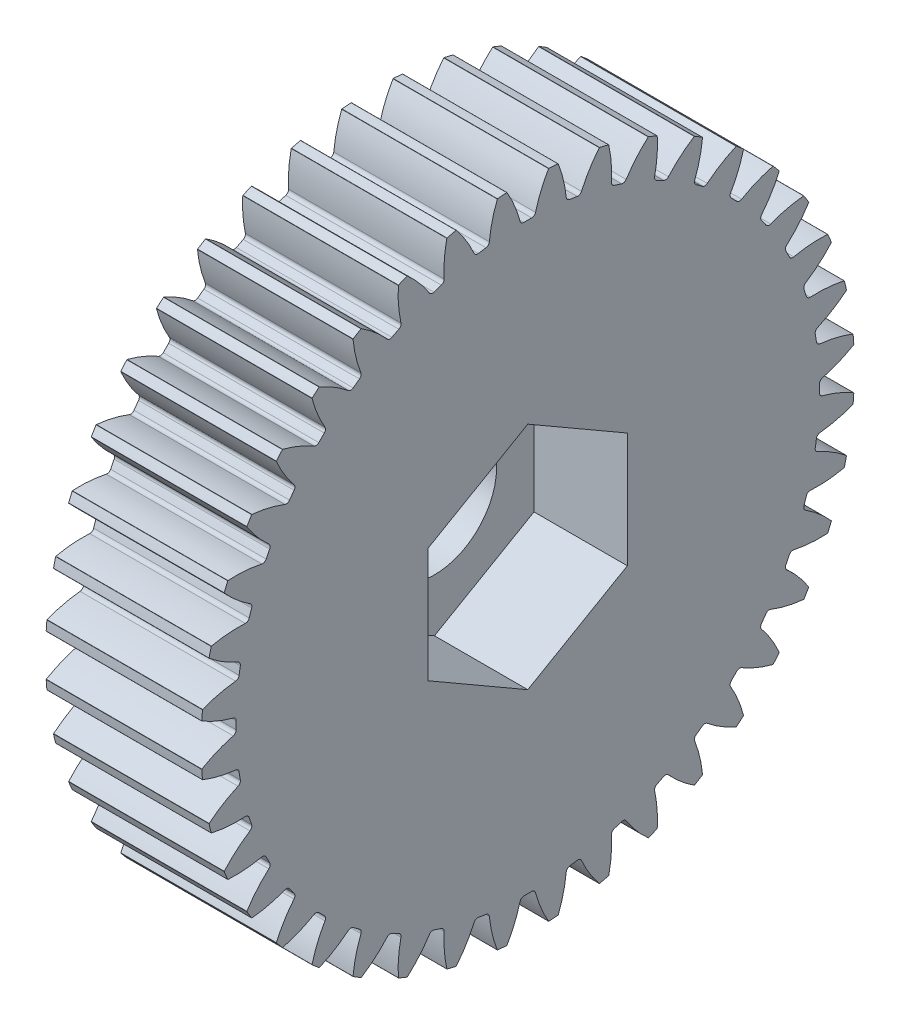
from build123d import *

# Parameters (mm, degrees)
BASPROSKE_W                = 14
BASPROSKE_H                = 21
TOOTHCUT_DEPTH             = 33.832910319
BREAKS_R                   = 0.02
ROOTFILLETS_R              = 0.251
TEETHCUTS_COUNT            = 40
TEETHCUTS_ANGLE            = 351
BREAKS_OF_TEETHCUTS_R      = 0.02
ROOTFILLETS_OF_TEETHCUTS_R = 0.251
BORSKE_R                   = 2
BORE_DEPTH                 = 50.0000508
CUT_EXTRUDE1_DEPTH         = 6
SKETCH1_7_R                = 4
CUT_EXTRUDE2_DEPTH         = 33.777200555
SKETCH2_R                  = 6.5
SKETCH2_R_2                = 4
BOSS_EXTRUDE1_DEPTH        = 3.8
SKETCH4_R                  = 6.5
CUT_EXTRUDE3_DEPTH         = 4
FILLET1_R                  = 3


with BuildPart() as part:
    # BasProSke → Base-Revolve (revolve)
    with BuildSketch(Plane(origin=(0, 0, 0), x_dir=(1, 0, 0), z_dir=(0, 1, 0)), mode=Mode.PRIVATE) as base_revolve_sk:
        with Locations((7, 10.5)):
            Rectangle(BASPROSKE_W, BASPROSKE_H)
    revolve(base_revolve_sk.sketch.rotate(Axis((-10, 0, 0), (1, 0, 0)), 180), axis=Axis((-10, 0, 0), (1, 0, 0)))

    # TooCutSke → ToothCut (cut, through all)
    with BuildSketch(Plane(origin=(0, 0, 0), x_dir=(0, 0, -1), z_dir=(1, 0, 0))):
        with BuildLine():
            ThreePointArc((0.448673268, 18.74363074), (0, 18.749), (-0.448673268, 18.74363074))
            ThreePointArc((-0.448673268, 18.74363074), (-0.816786816, 19.89705013), (-1.354745081, 20.981708961))
            ThreePointArc((-1.354745081, 20.981708961), (0, 21.0254), (1.354745081, 20.981708961))
            ThreePointArc((1.354745081, 20.981708961), (0.816786816, 19.89705013), (0.448673268, 18.74363074))
        make_face()
    toothcut = extrude(amount=TOOTHCUT_DEPTH, mode=Mode.SUBTRACT)

    # Breaks
    breaks_edges = [part.edges().sort_by_distance(p)[0] for p in [
        (7, 20.957189063, -1.34023378),
        (7, 20.957189063, 1.34023378),
    ]]
    fillet(breaks_edges, radius=BREAKS_R)

    # RootFillets
    rootfillets_edges = [part.edges().sort_by_distance(p)[0] for p in [
        (7, 18.74363074, -0.448673268),
        (7, 18.74363074, 0.448673268),
    ]]
    fillet(rootfillets_edges, radius=ROOTFILLETS_R)

    # TeethCuts: ToothCut ×40 about axis
    teethcuts_axis = Axis((-10, 0, 0), (1, 0, 0))
    for i in range(1, TEETHCUTS_COUNT):
        add(toothcut.rotate(teethcuts_axis, i * TEETHCUTS_ANGLE / (TEETHCUTS_COUNT - 1)), mode=Mode.SUBTRACT)

    # Breaks of TeethCuts
    breaks_of_teethcuts_edges = [part.edges().sort_by_distance(p)[0] for p in [
        (7, 20.908830043, 1.954693382),
        (7, 20.489512535, 4.602159938),
        (7, 20.345626236, 5.201489505),
        (7, 19.517316207, 7.750765644),
        (7, 19.281445587, 8.320207694),
        (7, 18.06453878, 10.708521777),
        (7, 17.742491756, 11.234054756),
        (7, 16.166952456, 13.402598565),
        (7, 15.766658895, 13.871282107),
        (7, 13.871282107, 15.766658895),
        (7, 13.402598565, 16.166952456),
        (7, 11.234054756, 17.742491756),
        (7, 10.708521777, 18.06453878),
        (7, 8.320207694, 19.281445587),
        (7, 7.750765644, 19.517316207),
        (7, 5.201489505, 20.345626236),
        (7, 4.602159938, 20.489512535),
        (7, 1.954693382, 20.908830043),
        (7, 1.34023378, 20.957189063),
        (7, -1.34023378, 20.957189063),
        (7, -1.954693382, 20.908830043),
        (7, -4.602159938, 20.489512535),
        (7, -5.201489505, 20.345626236),
        (7, -7.750765644, 19.517316207),
        (7, -8.320207694, 19.281445587),
        (7, -10.708521777, 18.06453878),
        (7, -11.234054756, 17.742491756),
        (7, -13.402598565, 16.166952456),
        (7, -13.871282107, 15.766658895),
        (7, -15.766658895, 13.871282107),
        (7, -16.166952456, 13.402598565),
        (7, -17.742491756, 11.234054756),
        (7, -18.06453878, 10.708521777),
        (7, -19.281445587, 8.320207694),
        (7, -19.517316207, 7.750765644),
        (7, -20.345626236, 5.201489505),
        (7, -20.489512535, 4.602159938),
        (7, -20.908830043, 1.954693382),
        (7, -20.957189063, 1.34023378),
        (7, -20.957189063, -1.34023378),
        (7, -20.908830043, -1.954693382),
        (7, -20.489512535, -4.602159938),
        (7, -20.345626236, -5.201489505),
        (7, -19.517316207, -7.750765644),
        (7, -19.281445587, -8.320207694),
        (7, -18.06453878, -10.708521777),
        (7, -17.742491756, -11.234054756),
        (7, -16.166952456, -13.402598565),
        (7, -15.766658895, -13.871282107),
        (7, -13.871282107, -15.766658895),
        (7, -13.402598565, -16.166952456),
        (7, -11.234054756, -17.742491756),
        (7, -10.708521777, -18.06453878),
        (7, -8.320207694, -19.281445587),
        (7, -7.750765644, -19.517316207),
        (7, -5.201489505, -20.345626236),
        (7, -4.602159938, -20.489512535),
        (7, -1.954693382, -20.908830043),
        (7, -1.34023378, -20.957189063),
        (7, 1.34023378, -20.957189063),
        (7, 1.954693382, -20.908830043),
        (7, 4.602159938, -20.489512535),
        (7, 5.201489505, -20.345626236),
        (7, 7.750765644, -19.517316207),
        (7, 8.320207694, -19.281445587),
        (7, 10.708521777, -18.06453878),
        (7, 11.234054756, -17.742491756),
        (7, 13.402598565, -16.166952456),
        (7, 13.871282107, -15.766658895),
        (7, 15.766658895, -13.871282107),
        (7, 16.166952456, -13.402598565),
        (7, 17.742491756, -11.234054756),
        (7, 18.06453878, -10.708521777),
        (7, 19.281445587, -8.320207694),
        (7, 19.517316207, -7.750765644),
        (7, 20.345626236, -5.201489505),
        (7, 20.489512535, -4.602159938),
        (7, 20.908830043, -1.954693382),
    ]]
    fillet(breaks_of_teethcuts_edges, radius=BREAKS_OF_TEETHCUTS_R)

    # RootFillets of TeethCuts
    rootfillets_of_teethcuts_edges = [part.edges().sort_by_distance(p)[0] for p in [
        (7, 18.583053504, 2.489000492),
        (7, 18.442677579, 3.375299203),
        (7, 17.964899819, 5.3653868),
        (7, 17.687604489, 6.21881407),
        (7, 16.904390677, 8.109659478),
        (7, 16.497003875, 8.909201095),
        (7, 15.427639334, 10.654245425),
        (7, 14.900192275, 11.380214022),
        (7, 13.57100831, 12.93648849),
        (7, 12.93648849, 13.57100831),
        (7, 11.380214022, 14.900192275),
        (7, 10.654245425, 15.427639334),
        (7, 8.909201095, 16.497003875),
        (7, 8.109659478, 16.904390677),
        (7, 6.21881407, 17.687604489),
        (7, 5.3653868, 17.964899819),
        (7, 3.375299203, 18.442677579),
        (7, 2.489000492, 18.583053504),
        (7, 0.448673268, 18.74363074),
        (7, -0.448673268, 18.74363074),
        (7, -2.489000492, 18.583053504),
        (7, -3.375299203, 18.442677579),
        (7, -5.3653868, 17.964899819),
        (7, -6.21881407, 17.687604489),
        (7, -8.109659478, 16.904390677),
        (7, -8.909201095, 16.497003875),
        (7, -10.654245425, 15.427639334),
        (7, -11.380214022, 14.900192275),
        (7, -12.93648849, 13.57100831),
        (7, -13.57100831, 12.93648849),
        (7, -14.900192275, 11.380214022),
        (7, -15.427639334, 10.654245425),
        (7, -16.497003875, 8.909201095),
        (7, -16.904390677, 8.109659478),
        (7, -17.687604489, 6.21881407),
        (7, -17.964899819, 5.3653868),
        (7, -18.442677579, 3.375299203),
        (7, -18.583053504, 2.489000492),
        (7, -18.74363074, 0.448673268),
        (7, -18.74363074, -0.448673268),
        (7, -18.583053504, -2.489000492),
        (7, -18.442677579, -3.375299203),
        (7, -17.964899819, -5.3653868),
        (7, -17.687604489, -6.21881407),
        (7, -16.904390677, -8.109659478),
        (7, -16.497003875, -8.909201095),
        (7, -15.427639334, -10.654245425),
        (7, -14.900192275, -11.380214022),
        (7, -13.57100831, -12.93648849),
        (7, -12.93648849, -13.57100831),
        (7, -11.380214022, -14.900192275),
        (7, -10.654245425, -15.427639334),
        (7, -8.909201095, -16.497003875),
        (7, -8.109659478, -16.904390677),
        (7, -6.21881407, -17.687604489),
        (7, -5.3653868, -17.964899819),
        (7, -3.375299203, -18.442677579),
        (7, -2.489000492, -18.583053504),
        (7, -0.448673268, -18.74363074),
        (7, 0.448673268, -18.74363074),
        (7, 2.489000492, -18.583053504),
        (7, 3.375299203, -18.442677579),
        (7, 5.3653868, -17.964899819),
        (7, 6.21881407, -17.687604489),
        (7, 8.109659478, -16.904390677),
        (7, 8.909201095, -16.497003875),
        (7, 10.654245425, -15.427639334),
        (7, 11.380214022, -14.900192275),
        (7, 12.93648849, -13.57100831),
        (7, 13.57100831, -12.93648849),
        (7, 14.900192275, -11.380214022),
        (7, 15.427639334, -10.654245425),
        (7, 16.497003875, -8.909201095),
        (7, 16.904390677, -8.109659478),
        (7, 17.687604489, -6.21881407),
        (7, 17.964899819, -5.3653868),
        (7, 18.442677579, -3.375299203),
        (7, 18.583053504, -2.489000492),
    ]]
    fillet(rootfillets_of_teethcuts_edges, radius=ROOTFILLETS_OF_TEETHCUTS_R)

    # BorSke → Bore (cut, symmetric)
    with BuildSketch(Plane(origin=(0, 0, 0), x_dir=(0, 0, -1), z_dir=(1, 0, 0))):
        with Locations(Location((0, 0, 0), (0, 0, 180))):
            Circle(BORSKE_R)
    extrude(amount=BORE_DEPTH, both=True, mode=Mode.SUBTRACT)

    # Sketch1 → Cut-Extrude1 (cut)
    with BuildSketch(Plane(origin=(14, 0, 0), x_dir=(0, 0, -1), z_dir=(1, 0, 0))):
        Polygon((0, 7.390083446), (-6.4, 3.695041723), (-6.4, -3.695041723), (0, -7.390083446), (6.4, -3.695041723), (6.4, 3.695041723), align=None)
    extrude(amount=-CUT_EXTRUDE1_DEPTH, mode=Mode.SUBTRACT)

    # Sketch1<7> → Cut-Extrude2 (cut, through all)
    with BuildSketch(Plane(origin=(14, 0, 0), x_dir=(0, 0, -1), z_dir=(1, 0, 0))):
        Circle(SKETCH1_7_R)
    extrude(amount=-CUT_EXTRUDE2_DEPTH, mode=Mode.SUBTRACT)

    # Sketch2 → Boss-Extrude1 (add)
    with BuildSketch(Plane.ZY):
        with Locations(Location((0, 0, 0), (0, 0, 180))):
            Circle(SKETCH2_R)
        with Locations(Location((0, 0, 0), (0, 0, 180))):
            Circle(SKETCH2_R_2, mode=Mode.SUBTRACT)
    extrude(amount=BOSS_EXTRUDE1_DEPTH)

    # Sketch4 → Cut-Extrude3 (cut)
    with BuildSketch(Plane.ZY):
        with BuildLine():
            ThreePointArc((-2.685424132, 18.555686412), (-2.932989785, 18.518168698), (-3.180032324, 18.477348171))
            ThreePointArc((-3.180032324, 18.477348171), (-3.341342555, 18.50357281), (-3.452314881, 18.623547246))
            ThreePointArc((-3.452314881, 18.623547246), (-3.959801668, 19.590849189), (-4.594327831, 20.48000184))
            ThreePointArc((-4.594327831, 20.48000184), (-4.603284888, 20.486217003), (-4.614170853, 20.486811058))
            ThreePointArc((-4.614170853, 20.486811058), (-4.902352641, 20.419768328), (-5.189561257, 20.348672044))
            ThreePointArc((-5.189561257, 20.348672044), (-5.198991027, 20.343200613), (-5.204150198, 20.333596443))
            ThreePointArc((-5.204150198, 20.333596443), (-5.365850293, 19.25328678), (-5.378878438, 18.161020258))
            ThreePointArc((-5.378878438, 18.161020258), (-5.423288251, 18.003741871), (-5.555110982, 17.907142234))
            ThreePointArc((-5.555110982, 17.907142234), (-5.793759628, 17.831358624), (-6.031374925, 17.752394698))
            ThreePointArc((-6.031374925, 17.752394698), (-6.194801598, 17.753061989), (-6.323175807, 17.854199444))
            ThreePointArc((-6.323175807, 17.854199444), (-6.975733951, 18.730203871), (-7.741542163, 19.509147816))
            ThreePointArc((-7.741542163, 19.509147816), (-7.75136121, 19.513885268), (-7.762206081, 19.512769069))
            ThreePointArc((-7.762206081, 19.512769069), (-8.03635208, 19.401470183), (-8.308902772, 19.286319886))
            ThreePointArc((-8.308902772, 19.286319886), (-8.317360525, 19.279440676), (-8.320953755, 19.269147677))
            ThreePointArc((-8.320953755, 19.269147677), (-8.311665389, 18.176842951), (-8.153665008, 17.095985991))
            ThreePointArc((-8.153665008, 17.095985991), (-8.172924301, 16.933696737), (-8.288012564, 16.817664783))
            ThreePointArc((-8.288012564, 16.817664783), (-8.51186788, 16.705481322), (-8.734205059, 16.590318351))
            ThreePointArc((-8.734205059, 16.590318351), (-8.895724065, 16.565411862), (-9.038339159, 16.645221997))
            ThreePointArc((-9.038339159, 16.645221997), (-9.819900513, 17.408358771), (-10.698134035, 18.057913826))
            ThreePointArc((-10.698134035, 18.057913826), (-10.708573294, 18.061056915), (-10.719110035, 18.058257947))
            ThreePointArc((-10.719110035, 18.058257947), (-10.972469859, 17.905443451), (-11.223651525, 17.749074524))
            ThreePointArc((-11.223651525, 17.749074524), (-11.230929004, 17.740956924), (-11.232867816, 17.730228544))
            ThreePointArc((-11.232867816, 17.730228544), (-11.052819699, 16.652824923), (-10.727681284, 15.609991811))
            ThreePointArc((-10.727681284, 15.609991811), (-10.721315831, 15.446687789), (-10.816835769, 15.31408061))
            ThreePointArc((-10.816835769, 15.31408061), (-11.020385695, 15.168259628), (-11.221970077, 15.019733306))
            ThreePointArc((-11.221970077, 15.019733306), (-11.377604283, 14.969866318), (-11.530948604, 15.026383942))
            ThreePointArc((-11.530948604, 15.026383942), (-12.422268535, 15.657862104), (-13.391302342, 16.162034067))
            ThreePointArc((-13.391302342, 16.162034067), (-13.402104763, 16.163505399), (-13.412073924, 16.159092581))
            ThreePointArc((-13.412073924, 16.159092581), (-13.638409015, 15.968525278), (-13.862036728, 15.774788042))
            ThreePointArc((-13.862036728, 15.774788042), (-13.867954737, 15.765631934), (-13.86819139, 15.754732342))
            ThreePointArc((-13.86819139, 15.754732342), (-13.521816906, 14.718759077), (-13.037546444, 13.739627826))
            ThreePointArc((-13.037546444, 13.739627826), (-13.005712983, 13.579330124), (-13.079312579, 13.433412949))
            ThreePointArc((-13.079312579, 13.433412949), (-13.25754504, 13.25754504), (-13.433412949, 13.079312579))
            ThreePointArc((-13.433412949, 13.079312579), (-13.579330124, 13.005712983), (-13.739627826, 13.037546444))
            ThreePointArc((-13.739627826, 13.037546444), (-14.718759077, 13.521816906), (-15.754732342, 13.86819139))
            ThreePointArc((-15.754732342, 13.86819139), (-15.765631934, 13.867954737), (-15.774788042, 13.862036728))
            ThreePointArc((-15.774788042, 13.862036728), (-15.968525278, 13.638409015), (-16.159092581, 13.412073924))
            ThreePointArc((-16.159092581, 13.412073924), (-16.163505399, 13.402104763), (-16.162034067, 13.391302342))
            ThreePointArc((-16.162034067, 13.391302342), (-15.657862104, 12.422268535), (-15.026383942, 11.530948604))
            ThreePointArc((-15.026383942, 11.530948604), (-14.969866318, 11.377604283), (-15.019733306, 11.221970077))
            ThreePointArc((-15.019733306, 11.221970077), (-15.168259628, 11.020385695), (-15.31408061, 10.816835769))
            ThreePointArc((-15.31408061, 10.816835769), (-15.446687789, 10.721315831), (-15.609991811, 10.727681284))
            ThreePointArc((-15.609991811, 10.727681284), (-16.652824923, 11.052819699), (-17.730228544, 11.232867816))
            ThreePointArc((-17.730228544, 11.232867816), (-17.740956924, 11.230929004), (-17.749074524, 11.223651525))
            ThreePointArc((-17.749074524, 11.223651525), (-17.905443451, 10.972469859), (-18.058257947, 10.719110035))
            ThreePointArc((-18.058257947, 10.719110035), (-18.061056915, 10.708573294), (-18.057913826, 10.698134035))
            ThreePointArc((-18.057913826, 10.698134035), (-17.408358771, 9.819900513), (-16.645221997, 9.038339159))
            ThreePointArc((-16.645221997, 9.038339159), (-16.565411862, 8.895724065), (-16.590318351, 8.734205059))
            ThreePointArc((-16.590318351, 8.734205059), (-16.705481322, 8.51186788), (-16.817664783, 8.288012564))
            ThreePointArc((-16.817664783, 8.288012564), (-16.933696737, 8.172924301), (-17.095985991, 8.153665008))
            ThreePointArc((-17.095985991, 8.153665008), (-18.176842951, 8.311665389), (-19.269147677, 8.320953755))
            ThreePointArc((-19.269147677, 8.320953755), (-19.279440676, 8.317360525), (-19.286319886, 8.308902772))
            ThreePointArc((-19.286319886, 8.308902772), (-19.401470183, 8.03635208), (-19.512769069, 7.762206081))
            ThreePointArc((-19.512769069, 7.762206081), (-19.513885268, 7.75136121), (-19.509147816, 7.741542163))
            ThreePointArc((-19.509147816, 7.741542163), (-18.730203871, 6.975733951), (-17.854199444, 6.323175807))
            ThreePointArc((-17.854199444, 6.323175807), (-17.753061989, 6.194801598), (-17.752394698, 6.031374925))
            ThreePointArc((-17.752394698, 6.031374925), (-17.831358624, 5.793759628), (-17.907142234, 5.555110982))
            ThreePointArc((-17.907142234, 5.555110982), (-18.003741871, 5.423288251), (-18.161020258, 5.378878438))
            ThreePointArc((-18.161020258, 5.378878438), (-19.25328678, 5.365850293), (-20.333596443, 5.204150198))
            ThreePointArc((-20.333596443, 5.204150198), (-20.343200613, 5.198991027), (-20.348672044, 5.189561257))
            ThreePointArc((-20.348672044, 5.189561257), (-20.419768328, 4.902352641), (-20.486811058, 4.614170853))
            ThreePointArc((-20.486811058, 4.614170853), (-20.486217003, 4.603284888), (-20.48000184, 4.594327831))
            ThreePointArc((-20.48000184, 4.594327831), (-19.590849189, 3.959801668), (-18.623547246, 3.452314881))
            ThreePointArc((-18.623547246, 3.452314881), (-18.50357281, 3.341342555), (-18.477348171, 3.180032324))
            ThreePointArc((-18.477348171, 3.180032324), (-18.518168698, 2.932989785), (-18.555686412, 2.685424132))
            ThreePointArc((-18.555686412, 2.685424132), (-18.630475129, 2.540112845), (-18.778869933, 2.47164603))
            ThreePointArc((-18.778869933, 2.47164603), (-19.855650791, 2.287910154), (-20.897364581, 1.959203192))
            ThreePointArc((-20.897364581, 1.959203192), (-20.906043436, 1.952605115), (-20.909972364, 1.942435521))
            ThreePointArc((-20.909972364, 1.942435521), (-20.935264008, 1.64764101), (-20.956399767, 1.352519425))
            ThreePointArc((-20.956399767, 1.352519425), (-20.954110086, 1.341860415), (-20.946570249, 1.3339859))
            ThreePointArc((-20.946570249, 1.3339859), (-19.969102782, 0.846365926), (-18.934321507, 0.496446506))
            ThreePointArc((-18.934321507, 0.496446506), (-18.798464259, 0.40560857), (-18.747328009, 0.250386772))
            ThreePointArc((-18.747328009, 0.250386772), (-18.749, 0), (-18.747328009, -0.250386772))
            ThreePointArc((-18.747328009, -0.250386772), (-18.798464259, -0.40560857), (-18.934321507, -0.496446506))
            ThreePointArc((-18.934321507, -0.496446506), (-19.969102782, -0.846365926), (-20.946570249, -1.3339859))
            ThreePointArc((-20.946570249, -1.3339859), (-20.954110086, -1.341860415), (-20.956399767, -1.352519425))
            ThreePointArc((-20.956399767, -1.352519425), (-20.935264008, -1.64764101), (-20.909972364, -1.942435521))
            ThreePointArc((-20.909972364, -1.942435521), (-20.906043436, -1.952605115), (-20.897364581, -1.959203192))
            ThreePointArc((-20.897364581, -1.959203192), (-19.855650791, -2.287910154), (-18.778869933, -2.47164603))
            ThreePointArc((-18.778869933, -2.47164603), (-18.630475129, -2.540112845), (-18.555686412, -2.685424132))
            ThreePointArc((-18.555686412, -2.685424132), (-18.518168698, -2.932989785), (-18.477348171, -3.180032324))
            ThreePointArc((-18.477348171, -3.180032324), (-18.50357281, -3.341342555), (-18.623547246, -3.452314881))
            ThreePointArc((-18.623547246, -3.452314881), (-19.590849189, -3.959801668), (-20.48000184, -4.594327831))
            ThreePointArc((-20.48000184, -4.594327831), (-20.486217003, -4.603284888), (-20.486811058, -4.614170853))
            ThreePointArc((-20.486811058, -4.614170853), (-20.419768328, -4.902352641), (-20.348672044, -5.189561257))
            ThreePointArc((-20.348672044, -5.189561257), (-20.343200613, -5.198991027), (-20.333596443, -5.204150198))
            ThreePointArc((-20.333596443, -5.204150198), (-19.25328678, -5.365850293), (-18.161020258, -5.378878438))
            ThreePointArc((-18.161020258, -5.378878438), (-18.003741871, -5.423288251), (-17.907142234, -5.555110982))
            ThreePointArc((-17.907142234, -5.555110982), (-17.831358624, -5.793759628), (-17.752394698, -6.031374925))
            ThreePointArc((-17.752394698, -6.031374925), (-17.753061989, -6.194801598), (-17.854199444, -6.323175807))
            ThreePointArc((-17.854199444, -6.323175807), (-18.730203871, -6.975733951), (-19.509147816, -7.741542163))
            ThreePointArc((-19.509147816, -7.741542163), (-19.513885268, -7.75136121), (-19.512769069, -7.762206081))
            ThreePointArc((-19.512769069, -7.762206081), (-19.401470183, -8.03635208), (-19.286319886, -8.308902772))
            ThreePointArc((-19.286319886, -8.308902772), (-19.279440676, -8.317360525), (-19.269147677, -8.320953755))
            ThreePointArc((-19.269147677, -8.320953755), (-18.176842951, -8.311665389), (-17.095985991, -8.153665008))
            ThreePointArc((-17.095985991, -8.153665008), (-16.933696737, -8.172924301), (-16.817664783, -8.288012564))
            ThreePointArc((-16.817664783, -8.288012564), (-16.705481322, -8.51186788), (-16.590318351, -8.734205059))
            ThreePointArc((-16.590318351, -8.734205059), (-16.565411862, -8.895724065), (-16.645221997, -9.038339159))
            ThreePointArc((-16.645221997, -9.038339159), (-17.408358771, -9.819900513), (-18.057913826, -10.698134035))
            ThreePointArc((-18.057913826, -10.698134035), (-18.061056915, -10.708573294), (-18.058257947, -10.719110035))
            ThreePointArc((-18.058257947, -10.719110035), (-17.905443451, -10.972469859), (-17.749074524, -11.223651525))
            ThreePointArc((-17.749074524, -11.223651525), (-17.740956924, -11.230929004), (-17.730228544, -11.232867816))
            ThreePointArc((-17.730228544, -11.232867816), (-16.652824923, -11.052819699), (-15.609991811, -10.727681284))
            ThreePointArc((-15.609991811, -10.727681284), (-15.446687789, -10.721315831), (-15.31408061, -10.816835769))
            ThreePointArc((-15.31408061, -10.816835769), (-15.168259628, -11.020385695), (-15.019733306, -11.221970077))
            ThreePointArc((-15.019733306, -11.221970077), (-14.969866318, -11.377604283), (-15.026383942, -11.530948604))
            ThreePointArc((-15.026383942, -11.530948604), (-15.657862104, -12.422268535), (-16.162034067, -13.391302342))
            ThreePointArc((-16.162034067, -13.391302342), (-16.163505399, -13.402104763), (-16.159092581, -13.412073924))
            ThreePointArc((-16.159092581, -13.412073924), (-15.968525278, -13.638409015), (-15.774788042, -13.862036728))
            ThreePointArc((-15.774788042, -13.862036728), (-15.765631934, -13.867954737), (-15.754732342, -13.86819139))
            ThreePointArc((-15.754732342, -13.86819139), (-14.718759077, -13.521816906), (-13.739627826, -13.037546444))
            ThreePointArc((-13.739627826, -13.037546444), (-13.579330124, -13.005712983), (-13.433412949, -13.079312579))
            ThreePointArc((-13.433412949, -13.079312579), (-13.25754504, -13.25754504), (-13.079312579, -13.433412949))
            ThreePointArc((-13.079312579, -13.433412949), (-13.005712983, -13.579330124), (-13.037546444, -13.739627826))
            ThreePointArc((-13.037546444, -13.739627826), (-13.521816906, -14.718759077), (-13.86819139, -15.754732342))
            ThreePointArc((-13.86819139, -15.754732342), (-13.867954737, -15.765631934), (-13.862036728, -15.774788042))
            ThreePointArc((-13.862036728, -15.774788042), (-13.638409015, -15.968525278), (-13.412073924, -16.159092581))
            ThreePointArc((-13.412073924, -16.159092581), (-13.402104763, -16.163505399), (-13.391302342, -16.162034067))
            ThreePointArc((-13.391302342, -16.162034067), (-12.422268535, -15.657862104), (-11.530948604, -15.026383942))
            ThreePointArc((-11.530948604, -15.026383942), (-11.377604283, -14.969866318), (-11.221970077, -15.019733306))
            ThreePointArc((-11.221970077, -15.019733306), (-11.020385695, -15.168259628), (-10.816835769, -15.31408061))
            ThreePointArc((-10.816835769, -15.31408061), (-10.721315831, -15.446687789), (-10.727681284, -15.609991811))
            ThreePointArc((-10.727681284, -15.609991811), (-11.052819699, -16.652824923), (-11.232867816, -17.730228544))
            ThreePointArc((-11.232867816, -17.730228544), (-11.230929004, -17.740956924), (-11.223651525, -17.749074524))
            ThreePointArc((-11.223651525, -17.749074524), (-10.972469859, -17.905443451), (-10.719110035, -18.058257947))
            ThreePointArc((-10.719110035, -18.058257947), (-10.708573294, -18.061056915), (-10.698134035, -18.057913826))
            ThreePointArc((-10.698134035, -18.057913826), (-9.819900513, -17.408358771), (-9.038339159, -16.645221997))
            ThreePointArc((-9.038339159, -16.645221997), (-8.895724065, -16.565411862), (-8.734205059, -16.590318351))
            ThreePointArc((-8.734205059, -16.590318351), (-8.51186788, -16.705481322), (-8.288012564, -16.817664783))
            ThreePointArc((-8.288012564, -16.817664783), (-8.172924301, -16.933696737), (-8.153665008, -17.095985991))
            ThreePointArc((-8.153665008, -17.095985991), (-8.311665389, -18.176842951), (-8.320953755, -19.269147677))
            ThreePointArc((-8.320953755, -19.269147677), (-8.317360525, -19.279440676), (-8.308902772, -19.286319886))
            ThreePointArc((-8.308902772, -19.286319886), (-8.03635208, -19.401470183), (-7.762206081, -19.512769069))
            ThreePointArc((-7.762206081, -19.512769069), (-7.75136121, -19.513885268), (-7.741542163, -19.509147816))
            ThreePointArc((-7.741542163, -19.509147816), (-6.975733951, -18.730203871), (-6.323175807, -17.854199444))
            ThreePointArc((-6.323175807, -17.854199444), (-6.194801598, -17.753061989), (-6.031374925, -17.752394698))
            ThreePointArc((-6.031374925, -17.752394698), (-5.793759628, -17.831358624), (-5.555110982, -17.907142234))
            ThreePointArc((-5.555110982, -17.907142234), (-5.423288251, -18.003741871), (-5.378878438, -18.161020258))
            ThreePointArc((-5.378878438, -18.161020258), (-5.365850293, -19.25328678), (-5.204150198, -20.333596443))
            ThreePointArc((-5.204150198, -20.333596443), (-5.198991027, -20.343200613), (-5.189561257, -20.348672044))
            ThreePointArc((-5.189561257, -20.348672044), (-4.902352641, -20.419768328), (-4.614170853, -20.486811058))
            ThreePointArc((-4.614170853, -20.486811058), (-4.603284888, -20.486217003), (-4.594327831, -20.48000184))
            ThreePointArc((-4.594327831, -20.48000184), (-3.959801668, -19.590849189), (-3.452314881, -18.623547246))
            ThreePointArc((-3.452314881, -18.623547246), (-3.341342555, -18.50357281), (-3.180032324, -18.477348171))
            ThreePointArc((-3.180032324, -18.477348171), (-2.932989785, -18.518168698), (-2.685424132, -18.555686412))
            ThreePointArc((-2.685424132, -18.555686412), (-2.540112845, -18.630475129), (-2.47164603, -18.778869933))
            ThreePointArc((-2.47164603, -18.778869933), (-2.287910154, -19.855650791), (-1.959203192, -20.897364581))
            ThreePointArc((-1.959203192, -20.897364581), (-1.952605115, -20.906043436), (-1.942435521, -20.909972364))
            ThreePointArc((-1.942435521, -20.909972364), (-1.64764101, -20.935264008), (-1.352519425, -20.956399767))
            ThreePointArc((-1.352519425, -20.956399767), (-1.341860415, -20.954110086), (-1.3339859, -20.946570249))
            ThreePointArc((-1.3339859, -20.946570249), (-0.846365926, -19.969102782), (-0.496446506, -18.934321507))
            ThreePointArc((-0.496446506, -18.934321507), (-0.40560857, -18.798464259), (-0.250386772, -18.747328009))
            ThreePointArc((-0.250386772, -18.747328009), (0, -18.749), (0.250386772, -18.747328009))
            ThreePointArc((0.250386772, -18.747328009), (0.40560857, -18.798464259), (0.496446506, -18.934321507))
            ThreePointArc((0.496446506, -18.934321507), (0.846365926, -19.969102782), (1.3339859, -20.946570249))
            ThreePointArc((1.3339859, -20.946570249), (1.341860415, -20.954110086), (1.352519425, -20.956399767))
            ThreePointArc((1.352519425, -20.956399767), (1.64764101, -20.935264008), (1.942435521, -20.909972364))
            ThreePointArc((1.942435521, -20.909972364), (1.952605115, -20.906043436), (1.959203192, -20.897364581))
            ThreePointArc((1.959203192, -20.897364581), (2.287910154, -19.855650791), (2.47164603, -18.778869933))
            ThreePointArc((2.47164603, -18.778869933), (2.540112845, -18.630475129), (2.685424132, -18.555686412))
            ThreePointArc((2.685424132, -18.555686412), (2.932989785, -18.518168698), (3.180032324, -18.477348171))
            ThreePointArc((3.180032324, -18.477348171), (3.341342555, -18.50357281), (3.452314881, -18.623547246))
            ThreePointArc((3.452314881, -18.623547246), (3.959801668, -19.590849189), (4.594327831, -20.48000184))
            ThreePointArc((4.594327831, -20.48000184), (4.603284888, -20.486217003), (4.614170853, -20.486811058))
            ThreePointArc((4.614170853, -20.486811058), (4.902352641, -20.419768328), (5.189561257, -20.348672044))
            ThreePointArc((5.189561257, -20.348672044), (5.198991027, -20.343200613), (5.204150198, -20.333596443))
            ThreePointArc((5.204150198, -20.333596443), (5.365850293, -19.25328678), (5.378878438, -18.161020258))
            ThreePointArc((5.378878438, -18.161020258), (5.423288251, -18.003741871), (5.555110982, -17.907142234))
            ThreePointArc((5.555110982, -17.907142234), (5.793759628, -17.831358624), (6.031374925, -17.752394698))
            ThreePointArc((6.031374925, -17.752394698), (6.194801598, -17.753061989), (6.323175807, -17.854199444))
            ThreePointArc((6.323175807, -17.854199444), (6.975733951, -18.730203871), (7.741542163, -19.509147816))
            ThreePointArc((7.741542163, -19.509147816), (7.75136121, -19.513885268), (7.762206081, -19.512769069))
            ThreePointArc((7.762206081, -19.512769069), (8.03635208, -19.401470183), (8.308902772, -19.286319886))
            ThreePointArc((8.308902772, -19.286319886), (8.317360525, -19.279440676), (8.320953755, -19.269147677))
            ThreePointArc((8.320953755, -19.269147677), (8.311665389, -18.176842951), (8.153665008, -17.095985991))
            ThreePointArc((8.153665008, -17.095985991), (8.172924301, -16.933696737), (8.288012564, -16.817664783))
            ThreePointArc((8.288012564, -16.817664783), (8.51186788, -16.705481322), (8.734205059, -16.590318351))
            ThreePointArc((8.734205059, -16.590318351), (8.895724065, -16.565411862), (9.038339159, -16.645221997))
            ThreePointArc((9.038339159, -16.645221997), (9.819900513, -17.408358771), (10.698134035, -18.057913826))
            ThreePointArc((10.698134035, -18.057913826), (10.708573294, -18.061056915), (10.719110035, -18.058257947))
            ThreePointArc((10.719110035, -18.058257947), (10.972469859, -17.905443451), (11.223651525, -17.749074524))
            ThreePointArc((11.223651525, -17.749074524), (11.230929004, -17.740956924), (11.232867816, -17.730228544))
            ThreePointArc((11.232867816, -17.730228544), (11.052819699, -16.652824923), (10.727681284, -15.609991811))
            ThreePointArc((10.727681284, -15.609991811), (10.721315831, -15.446687789), (10.816835769, -15.31408061))
            ThreePointArc((10.816835769, -15.31408061), (11.020385695, -15.168259628), (11.221970077, -15.019733306))
            ThreePointArc((11.221970077, -15.019733306), (11.377604283, -14.969866318), (11.530948604, -15.026383942))
            ThreePointArc((11.530948604, -15.026383942), (12.422268535, -15.657862104), (13.391302342, -16.162034067))
            ThreePointArc((13.391302342, -16.162034067), (13.402104763, -16.163505399), (13.412073924, -16.159092581))
            ThreePointArc((13.412073924, -16.159092581), (13.638409015, -15.968525278), (13.862036728, -15.774788042))
            ThreePointArc((13.862036728, -15.774788042), (13.867954737, -15.765631934), (13.86819139, -15.754732342))
            ThreePointArc((13.86819139, -15.754732342), (13.521816906, -14.718759077), (13.037546444, -13.739627826))
            ThreePointArc((13.037546444, -13.739627826), (13.005712983, -13.579330124), (13.079312579, -13.433412949))
            ThreePointArc((13.079312579, -13.433412949), (13.25754504, -13.25754504), (13.433412949, -13.079312579))
            ThreePointArc((13.433412949, -13.079312579), (13.579330124, -13.005712983), (13.739627826, -13.037546444))
            ThreePointArc((13.739627826, -13.037546444), (14.718759077, -13.521816906), (15.754732342, -13.86819139))
            ThreePointArc((15.754732342, -13.86819139), (15.765631934, -13.867954737), (15.774788042, -13.862036728))
            ThreePointArc((15.774788042, -13.862036728), (15.968525278, -13.638409015), (16.159092581, -13.412073924))
            ThreePointArc((16.159092581, -13.412073924), (16.163505399, -13.402104763), (16.162034067, -13.391302342))
            ThreePointArc((16.162034067, -13.391302342), (15.657862104, -12.422268535), (15.026383942, -11.530948604))
            ThreePointArc((15.026383942, -11.530948604), (14.969866318, -11.377604283), (15.019733306, -11.221970077))
            ThreePointArc((15.019733306, -11.221970077), (15.168259628, -11.020385695), (15.31408061, -10.816835769))
            ThreePointArc((15.31408061, -10.816835769), (15.446687789, -10.721315831), (15.609991811, -10.727681284))
            ThreePointArc((15.609991811, -10.727681284), (16.652824923, -11.052819699), (17.730228544, -11.232867816))
            ThreePointArc((17.730228544, -11.232867816), (17.740956924, -11.230929004), (17.749074524, -11.223651525))
            ThreePointArc((17.749074524, -11.223651525), (17.905443451, -10.972469859), (18.058257947, -10.719110035))
            ThreePointArc((18.058257947, -10.719110035), (18.061056915, -10.708573294), (18.057913826, -10.698134035))
            ThreePointArc((18.057913826, -10.698134035), (17.408358771, -9.819900513), (16.645221997, -9.038339159))
            ThreePointArc((16.645221997, -9.038339159), (16.565411862, -8.895724065), (16.590318351, -8.734205059))
            ThreePointArc((16.590318351, -8.734205059), (16.705481322, -8.51186788), (16.817664783, -8.288012564))
            ThreePointArc((16.817664783, -8.288012564), (16.933696737, -8.172924301), (17.095985991, -8.153665008))
            ThreePointArc((17.095985991, -8.153665008), (18.176842951, -8.311665389), (19.269147677, -8.320953755))
            ThreePointArc((19.269147677, -8.320953755), (19.279440676, -8.317360525), (19.286319886, -8.308902772))
            ThreePointArc((19.286319886, -8.308902772), (19.401470183, -8.03635208), (19.512769069, -7.762206081))
            ThreePointArc((19.512769069, -7.762206081), (19.513885268, -7.75136121), (19.509147816, -7.741542163))
            ThreePointArc((19.509147816, -7.741542163), (18.730203871, -6.975733951), (17.854199444, -6.323175807))
            ThreePointArc((17.854199444, -6.323175807), (17.753061989, -6.194801598), (17.752394698, -6.031374925))
            ThreePointArc((17.752394698, -6.031374925), (17.831358624, -5.793759628), (17.907142234, -5.555110982))
            ThreePointArc((17.907142234, -5.555110982), (18.003741871, -5.423288251), (18.161020258, -5.378878438))
            ThreePointArc((18.161020258, -5.378878438), (19.25328678, -5.365850293), (20.333596443, -5.204150198))
            ThreePointArc((20.333596443, -5.204150198), (20.343200613, -5.198991027), (20.348672044, -5.189561257))
            ThreePointArc((20.348672044, -5.189561257), (20.419768328, -4.902352641), (20.486811058, -4.614170853))
            ThreePointArc((20.486811058, -4.614170853), (20.486217003, -4.603284888), (20.48000184, -4.594327831))
            ThreePointArc((20.48000184, -4.594327831), (19.590849189, -3.959801668), (18.623547246, -3.452314881))
            ThreePointArc((18.623547246, -3.452314881), (18.50357281, -3.341342555), (18.477348171, -3.180032324))
            ThreePointArc((18.477348171, -3.180032324), (18.518168698, -2.932989785), (18.555686412, -2.685424132))
            ThreePointArc((18.555686412, -2.685424132), (18.630475129, -2.540112845), (18.778869933, -2.47164603))
            ThreePointArc((18.778869933, -2.47164603), (19.855650791, -2.287910154), (20.897364581, -1.959203192))
            ThreePointArc((20.897364581, -1.959203192), (20.906043436, -1.952605115), (20.909972364, -1.942435521))
            ThreePointArc((20.909972364, -1.942435521), (20.935264008, -1.64764101), (20.956399767, -1.352519425))
            ThreePointArc((20.956399767, -1.352519425), (20.954110086, -1.341860415), (20.946570249, -1.3339859))
            ThreePointArc((20.946570249, -1.3339859), (19.969102782, -0.846365926), (18.934321507, -0.496446506))
            ThreePointArc((18.934321507, -0.496446506), (18.798464259, -0.40560857), (18.747328009, -0.250386772))
            ThreePointArc((18.747328009, -0.250386772), (18.749, 0), (18.747328009, 0.250386772))
            ThreePointArc((18.747328009, 0.250386772), (18.798464259, 0.40560857), (18.934321507, 0.496446506))
            ThreePointArc((18.934321507, 0.496446506), (19.969102782, 0.846365926), (20.946570249, 1.3339859))
            ThreePointArc((20.946570249, 1.3339859), (20.954110086, 1.341860415), (20.956399767, 1.352519425))
            ThreePointArc((20.956399767, 1.352519425), (20.935264008, 1.64764101), (20.909972364, 1.942435521))
            ThreePointArc((20.909972364, 1.942435521), (20.906043436, 1.952605115), (20.897364581, 1.959203192))
            ThreePointArc((20.897364581, 1.959203192), (19.855650791, 2.287910154), (18.778869933, 2.47164603))
            ThreePointArc((18.778869933, 2.47164603), (18.630475129, 2.540112845), (18.555686412, 2.685424132))
            ThreePointArc((18.555686412, 2.685424132), (18.518168698, 2.932989785), (18.477348171, 3.180032324))
            ThreePointArc((18.477348171, 3.180032324), (18.50357281, 3.341342555), (18.623547246, 3.452314881))
            ThreePointArc((18.623547246, 3.452314881), (19.590849189, 3.959801668), (20.48000184, 4.594327831))
            ThreePointArc((20.48000184, 4.594327831), (20.486217003, 4.603284888), (20.486811058, 4.614170853))
            ThreePointArc((20.486811058, 4.614170853), (20.419768328, 4.902352641), (20.348672044, 5.189561257))
            ThreePointArc((20.348672044, 5.189561257), (20.343200613, 5.198991027), (20.333596443, 5.204150198))
            ThreePointArc((20.333596443, 5.204150198), (19.25328678, 5.365850293), (18.161020258, 5.378878438))
            ThreePointArc((18.161020258, 5.378878438), (18.003741871, 5.423288251), (17.907142234, 5.555110982))
            ThreePointArc((17.907142234, 5.555110982), (17.831358624, 5.793759628), (17.752394698, 6.031374925))
            ThreePointArc((17.752394698, 6.031374925), (17.753061989, 6.194801598), (17.854199444, 6.323175807))
            ThreePointArc((17.854199444, 6.323175807), (18.730203871, 6.975733951), (19.509147816, 7.741542163))
            ThreePointArc((19.509147816, 7.741542163), (19.513885268, 7.75136121), (19.512769069, 7.762206081))
            ThreePointArc((19.512769069, 7.762206081), (19.401470183, 8.03635208), (19.286319886, 8.308902772))
            ThreePointArc((19.286319886, 8.308902772), (19.279440676, 8.317360525), (19.269147677, 8.320953755))
            ThreePointArc((19.269147677, 8.320953755), (18.176842951, 8.311665389), (17.095985991, 8.153665008))
            ThreePointArc((17.095985991, 8.153665008), (16.933696737, 8.172924301), (16.817664783, 8.288012564))
            ThreePointArc((16.817664783, 8.288012564), (16.705481322, 8.51186788), (16.590318351, 8.734205059))
            ThreePointArc((16.590318351, 8.734205059), (16.565411862, 8.895724065), (16.645221997, 9.038339159))
            ThreePointArc((16.645221997, 9.038339159), (17.408358771, 9.819900513), (18.057913826, 10.698134035))
            ThreePointArc((18.057913826, 10.698134035), (18.061056915, 10.708573294), (18.058257947, 10.719110035))
            ThreePointArc((18.058257947, 10.719110035), (17.905443451, 10.972469859), (17.749074524, 11.223651525))
            ThreePointArc((17.749074524, 11.223651525), (17.740956924, 11.230929004), (17.730228544, 11.232867816))
            ThreePointArc((17.730228544, 11.232867816), (16.652824923, 11.052819699), (15.609991811, 10.727681284))
            ThreePointArc((15.609991811, 10.727681284), (15.446687789, 10.721315831), (15.31408061, 10.816835769))
            ThreePointArc((15.31408061, 10.816835769), (15.168259628, 11.020385695), (15.019733306, 11.221970077))
            ThreePointArc((15.019733306, 11.221970077), (14.969866318, 11.377604283), (15.026383942, 11.530948604))
            ThreePointArc((15.026383942, 11.530948604), (15.657862104, 12.422268535), (16.162034067, 13.391302342))
            ThreePointArc((16.162034067, 13.391302342), (16.163505399, 13.402104763), (16.159092581, 13.412073924))
            ThreePointArc((16.159092581, 13.412073924), (15.968525278, 13.638409015), (15.774788042, 13.862036728))
            ThreePointArc((15.774788042, 13.862036728), (15.765631934, 13.867954737), (15.754732342, 13.86819139))
            ThreePointArc((15.754732342, 13.86819139), (14.718759077, 13.521816906), (13.739627826, 13.037546444))
            ThreePointArc((13.739627826, 13.037546444), (13.579330124, 13.005712983), (13.433412949, 13.079312579))
            ThreePointArc((13.433412949, 13.079312579), (13.25754504, 13.25754504), (13.079312579, 13.433412949))
            ThreePointArc((13.079312579, 13.433412949), (13.005712983, 13.579330124), (13.037546444, 13.739627826))
            ThreePointArc((13.037546444, 13.739627826), (13.521816906, 14.718759077), (13.86819139, 15.754732342))
            ThreePointArc((13.86819139, 15.754732342), (13.867954737, 15.765631934), (13.862036728, 15.774788042))
            ThreePointArc((13.862036728, 15.774788042), (13.638409015, 15.968525278), (13.412073924, 16.159092581))
            ThreePointArc((13.412073924, 16.159092581), (13.402104763, 16.163505399), (13.391302342, 16.162034067))
            ThreePointArc((13.391302342, 16.162034067), (12.422268535, 15.657862104), (11.530948604, 15.026383942))
            ThreePointArc((11.530948604, 15.026383942), (11.377604283, 14.969866318), (11.221970077, 15.019733306))
            ThreePointArc((11.221970077, 15.019733306), (11.020385695, 15.168259628), (10.816835769, 15.31408061))
            ThreePointArc((10.816835769, 15.31408061), (10.721315831, 15.446687789), (10.727681284, 15.609991811))
            ThreePointArc((10.727681284, 15.609991811), (11.052819699, 16.652824923), (11.232867816, 17.730228544))
            ThreePointArc((11.232867816, 17.730228544), (11.230929004, 17.740956924), (11.223651525, 17.749074524))
            ThreePointArc((11.223651525, 17.749074524), (10.972469859, 17.905443451), (10.719110035, 18.058257947))
            ThreePointArc((10.719110035, 18.058257947), (10.708573294, 18.061056915), (10.698134035, 18.057913826))
            ThreePointArc((10.698134035, 18.057913826), (9.819900513, 17.408358771), (9.038339159, 16.645221997))
            ThreePointArc((9.038339159, 16.645221997), (8.895724065, 16.565411862), (8.734205059, 16.590318351))
            ThreePointArc((8.734205059, 16.590318351), (8.51186788, 16.705481322), (8.288012564, 16.817664783))
            ThreePointArc((8.288012564, 16.817664783), (8.172924301, 16.933696737), (8.153665008, 17.095985991))
            ThreePointArc((8.153665008, 17.095985991), (8.311665389, 18.176842951), (8.320953755, 19.269147677))
            ThreePointArc((8.320953755, 19.269147677), (8.317360525, 19.279440676), (8.308902772, 19.286319886))
            ThreePointArc((8.308902772, 19.286319886), (8.03635208, 19.401470183), (7.762206081, 19.512769069))
            ThreePointArc((7.762206081, 19.512769069), (7.75136121, 19.513885268), (7.741542163, 19.509147816))
            ThreePointArc((7.741542163, 19.509147816), (6.975733951, 18.730203871), (6.323175807, 17.854199444))
            ThreePointArc((6.323175807, 17.854199444), (6.194801598, 17.753061989), (6.031374925, 17.752394698))
            ThreePointArc((6.031374925, 17.752394698), (5.793759628, 17.831358624), (5.555110982, 17.907142234))
            ThreePointArc((5.555110982, 17.907142234), (5.423288251, 18.003741871), (5.378878438, 18.161020258))
            ThreePointArc((5.378878438, 18.161020258), (5.365850293, 19.25328678), (5.204150198, 20.333596443))
            ThreePointArc((5.204150198, 20.333596443), (5.198991027, 20.343200613), (5.189561257, 20.348672044))
            ThreePointArc((5.189561257, 20.348672044), (4.902352641, 20.419768328), (4.614170853, 20.486811058))
            ThreePointArc((4.614170853, 20.486811058), (4.603284888, 20.486217003), (4.594327831, 20.48000184))
            ThreePointArc((4.594327831, 20.48000184), (3.959801668, 19.590849189), (3.452314881, 18.623547246))
            ThreePointArc((3.452314881, 18.623547246), (3.341342555, 18.50357281), (3.180032324, 18.477348171))
            ThreePointArc((3.180032324, 18.477348171), (2.932989785, 18.518168698), (2.685424132, 18.555686412))
            ThreePointArc((2.685424132, 18.555686412), (2.540112845, 18.630475129), (2.47164603, 18.778869933))
            ThreePointArc((2.47164603, 18.778869933), (2.287910154, 19.855650791), (1.959203192, 20.897364581))
            ThreePointArc((1.959203192, 20.897364581), (1.952605115, 20.906043436), (1.942435521, 20.909972364))
            ThreePointArc((1.942435521, 20.909972364), (1.64764101, 20.935264008), (1.352519425, 20.956399767))
            ThreePointArc((1.352519425, 20.956399767), (1.341860415, 20.954110086), (1.3339859, 20.946570249))
            ThreePointArc((1.3339859, 20.946570249), (0.846365926, 19.969102782), (0.496446506, 18.934321507))
            ThreePointArc((0.496446506, 18.934321507), (0.40560857, 18.798464259), (0.250386772, 18.747328009))
            ThreePointArc((0.250386772, 18.747328009), (0, 18.749), (-0.250386772, 18.747328009))
            ThreePointArc((-0.250386772, 18.747328009), (-0.40560857, 18.798464259), (-0.496446506, 18.934321507))
            ThreePointArc((-0.496446506, 18.934321507), (-0.846365926, 19.969102782), (-1.3339859, 20.946570249))
            ThreePointArc((-1.3339859, 20.946570249), (-1.341860415, 20.954110086), (-1.352519425, 20.956399767))
            ThreePointArc((-1.352519425, 20.956399767), (-1.64764101, 20.935264008), (-1.942435521, 20.909972364))
            ThreePointArc((-1.942435521, 20.909972364), (-1.952605115, 20.906043436), (-1.959203192, 20.897364581))
            ThreePointArc((-1.959203192, 20.897364581), (-2.287910154, 19.855650791), (-2.47164603, 18.778869933))
            ThreePointArc((-2.47164603, 18.778869933), (-2.540112845, 18.630475129), (-2.685424132, 18.555686412))
        make_face()
        with Locations(Location((0, 0, 0), (0, 0, 180))):
            Circle(SKETCH4_R, mode=Mode.SUBTRACT)
    extrude(amount=-CUT_EXTRUDE3_DEPTH, mode=Mode.SUBTRACT)

    # Fillet1
    fillet1_edges = [part.edges().sort_by_distance(p)[0] for p in [
        (4, 0, 6.5),
    ]]
    fillet(fillet1_edges, radius=FILLET1_R)


solid = part.part
